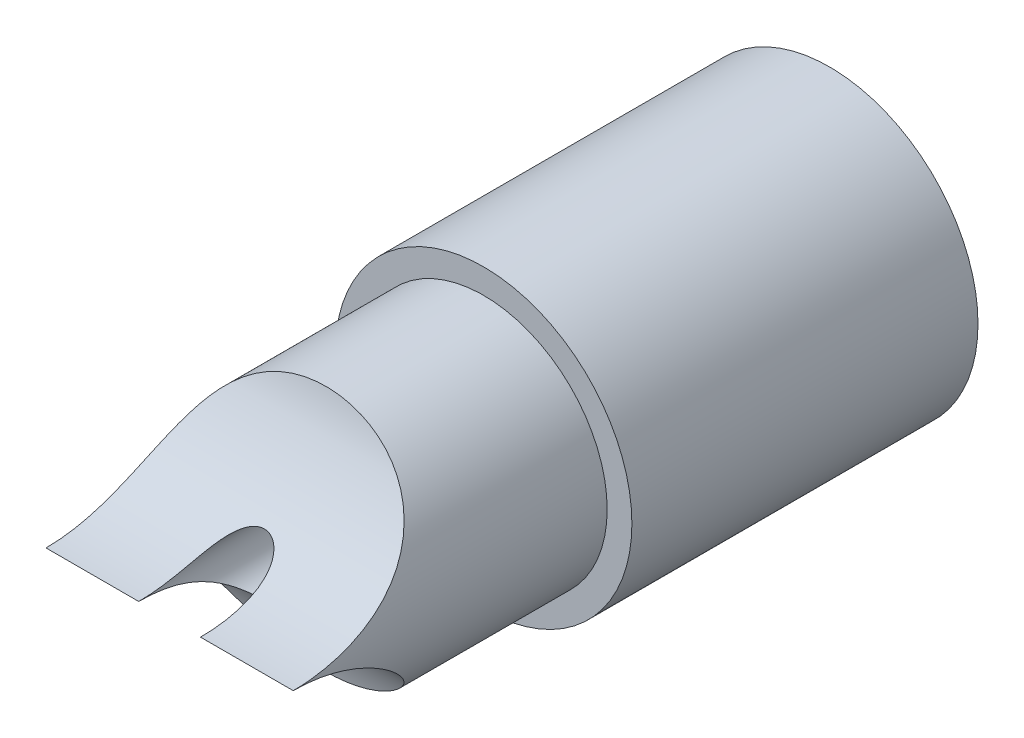
from build123d import *

# Parameters (mm, degrees)
BASE_SKETCH_R           = 6
BOSS_EXTRUDE1_DEPTH     = 14
SKETCH2_R               = 5
BOSS_EXTRUDE2_DEPTH     = 12.7
SKETCH3_R               = 1.25
CUT_EXTRUDE1_DEPTH      = 29.015888349
SKETCH4_R               = 2.25
CUT_EXTRUDE2_DEPTH      = 5
CUT_EXTRUDE3_DEPTH      = 29.015888349
CUT_EXTRUDE3_DEPTH_BACK = 29.015888349
SKETCH5_R               = 6.5


with BuildPart() as part:
    # Base sketch → Boss-Extrude1 (new body)
    with BuildSketch(Plane.XY):
        Circle(BASE_SKETCH_R)
    extrude(amount=BOSS_EXTRUDE1_DEPTH)

    # Sketch2 → Boss-Extrude2 (add)
    with BuildSketch(Plane.XY.offset(14)):
        Circle(SKETCH2_R)
    extrude(amount=BOSS_EXTRUDE2_DEPTH)

    # Sketch3 → Cut-Extrude1 (cut, through all)
    with BuildSketch(Plane.XY.offset(26.7)):
        Circle(SKETCH3_R)
    extrude(amount=-CUT_EXTRUDE1_DEPTH, mode=Mode.SUBTRACT)

    # Sketch4 → Cut-Extrude2 (cut)
    with BuildSketch(Plane(origin=(0, 0, 0), x_dir=(-1, 0, 0), z_dir=(0, 0, -1))):
        Circle(SKETCH4_R)
    extrude(amount=-CUT_EXTRUDE2_DEPTH, mode=Mode.SUBTRACT)

    # Sketch5 → Cut-Extrude3 (cut, two sides: drawn at the far end of the back side and taken through both)
    with BuildSketch(Plane(origin=(0, 0, 0), x_dir=(0, 0, -1), z_dir=(1, 0, 0)).offset(-CUT_EXTRUDE3_DEPTH_BACK)):
        with Locations((-26.7, 6.5)):
            Circle(SKETCH5_R)
        with Locations((-26.7, -6.5)):
            Circle(SKETCH5_R)
    extrude(amount=CUT_EXTRUDE3_DEPTH + CUT_EXTRUDE3_DEPTH_BACK, mode=Mode.SUBTRACT)


solid = part.part
